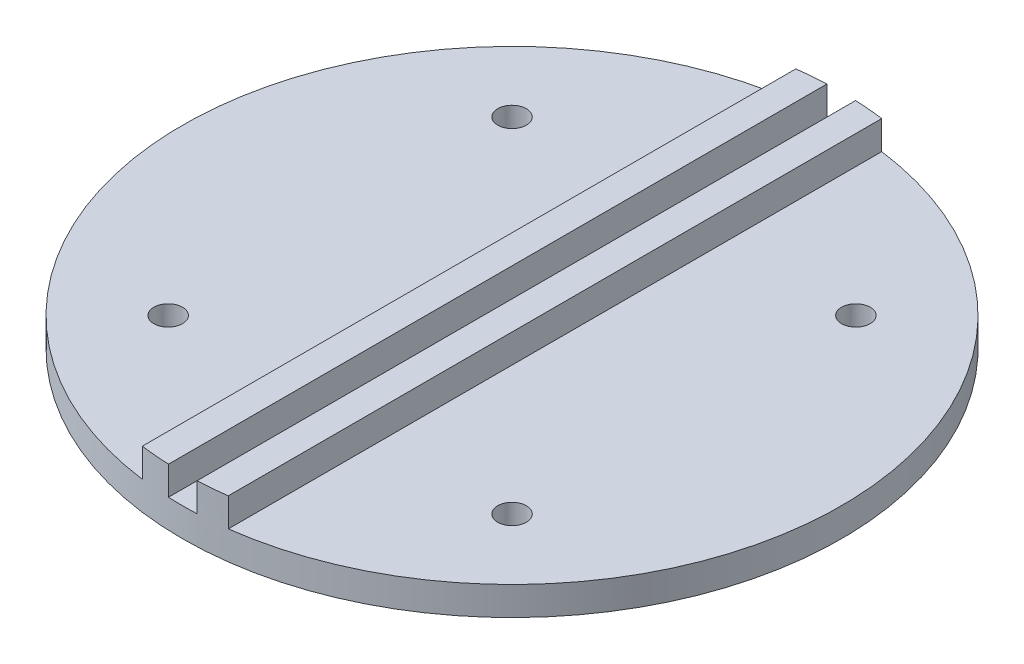
from build123d import *

# Parameters (mm, degrees)
SKETCH5_R           = 73.025
SKETCH5_R_2         = 3.175
BOSS_EXTRUDE1_DEPTH = 6.35
BOSS_EXTRUDE3_DEPTH = 6.35


with BuildPart() as part:
    # Sketch5 → Boss-Extrude1 (new body)
    with BuildSketch(Plane(origin=(0, 0, 0), x_dir=(1, 0, 0), z_dir=(0, 1, 0))):
        Circle(SKETCH5_R)
        with Locations((38.1, 38.1)):
            Circle(SKETCH5_R_2, mode=Mode.SUBTRACT)
        with Locations((38.1, -38.1)):
            Circle(SKETCH5_R_2, mode=Mode.SUBTRACT)
        with Locations((-38.1, 38.1)):
            Circle(SKETCH5_R_2, mode=Mode.SUBTRACT)
        with Locations((-38.1, -38.1)):
            Circle(SKETCH5_R_2, mode=Mode.SUBTRACT)
    extrude(amount=BOSS_EXTRUDE1_DEPTH)

    # Sketch6 → Boss-Extrude3 (add)
    with BuildSketch(Plane(origin=(0, 6.35, 0), x_dir=(1, 0, 0), z_dir=(0, 1, 0))):
        with BuildLine():
            Line((3.175, 72.955945611), (3.175, -72.955945611))
            ThreePointArc((3.175, -72.955945611), (6.35605636, -72.747860261), (9.525, -72.401139494))
            Line((9.525, -72.401139494), (9.525, 72.401139494))
            ThreePointArc((9.525, 72.401139494), (6.35605636, 72.747860261), (3.175, 72.955945611))
        make_face()
        with BuildLine():
            Line((-3.175, -72.955945611), (-3.175, 72.955945611))
            ThreePointArc((-3.175, 72.955945611), (-6.35605636, 72.747860261), (-9.525, 72.401139494))
            Line((-9.525, 72.401139494), (-9.525, -72.401139494))
            ThreePointArc((-9.525, -72.401139494), (-6.35605636, -72.747860261), (-3.175, -72.955945611))
        make_face()
    extrude(amount=BOSS_EXTRUDE3_DEPTH)


solid = part.part
